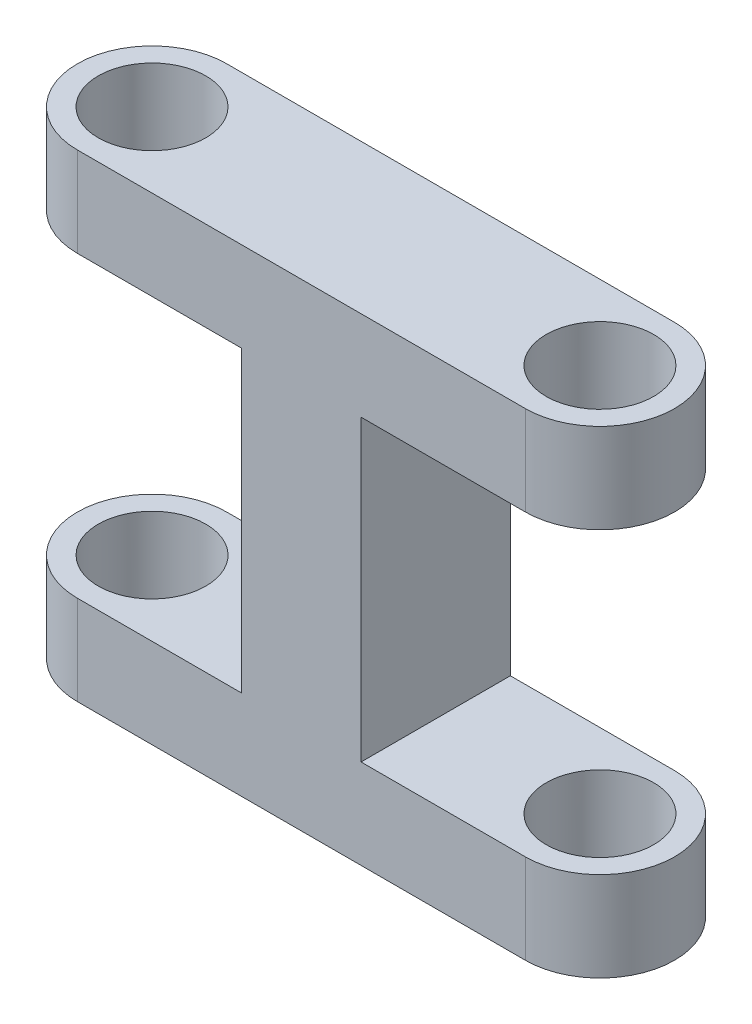
from build123d import *

# Parameters (mm, degrees)
SKETCH_1_R          = 1.8
EXTRUDE_1_DEPTH     = 16
CUT_EXTRUDE_1_REACH = 29.263
SKETCH_2_W          = 8
SKETCH_2_H          = 10


with BuildPart() as part:
    # 草图1 → 凸台-拉伸1 (new body)
    with BuildSketch(Plane(origin=(0, 0, 0), x_dir=(1, 0, 0), z_dir=(0, 1, 0))):
        with BuildLine():
            Line((19, -1.5), (4, -1.5))
            ThreePointArc((4, -1.5), (1.5, -4), (4, -6.5))
            Line((4, -6.5), (19, -6.5))
            ThreePointArc((19, -6.5), (21.5, -4), (19, -1.5))
        make_face()
        with Locations((19, -4)):
            Circle(SKETCH_1_R, mode=Mode.SUBTRACT)
        with Locations((4, -4)):
            Circle(SKETCH_1_R, mode=Mode.SUBTRACT)
    extrude(amount=EXTRUDE_1_DEPTH)

    # 草图2 → 切除-拉伸1 (cut, up to next)
    with BuildSketch(Plane.XY.offset(6.5), mode=Mode.PRIVATE) as cut_extrude_1_sk1:
        with Locations((17.5, 8)):
            Rectangle(SKETCH_2_W, SKETCH_2_H)
    cut_extrude_1_tool1 = extrude(cut_extrude_1_sk1.sketch, amount=-CUT_EXTRUDE_1_REACH, mode=Mode.PRIVATE) & part.part
    # 草图2 → 切除-拉伸1 (cut, up to next)
    with BuildSketch(Plane.XY.offset(6.5), mode=Mode.PRIVATE) as cut_extrude_1_sk2:
        with Locations((5.5, 8)):
            Rectangle(SKETCH_2_W, SKETCH_2_H)
    cut_extrude_1_tool2 = extrude(cut_extrude_1_sk2.sketch, amount=-CUT_EXTRUDE_1_REACH, mode=Mode.PRIVATE) & part.part
    add(cut_extrude_1_tool1.solids().sort_by_distance((17.5, 8, 6.5))[0], mode=Mode.SUBTRACT)
    add(cut_extrude_1_tool2.solids().sort_by_distance((5.5, 8, 6.5))[0], mode=Mode.SUBTRACT)


solid = part.part
